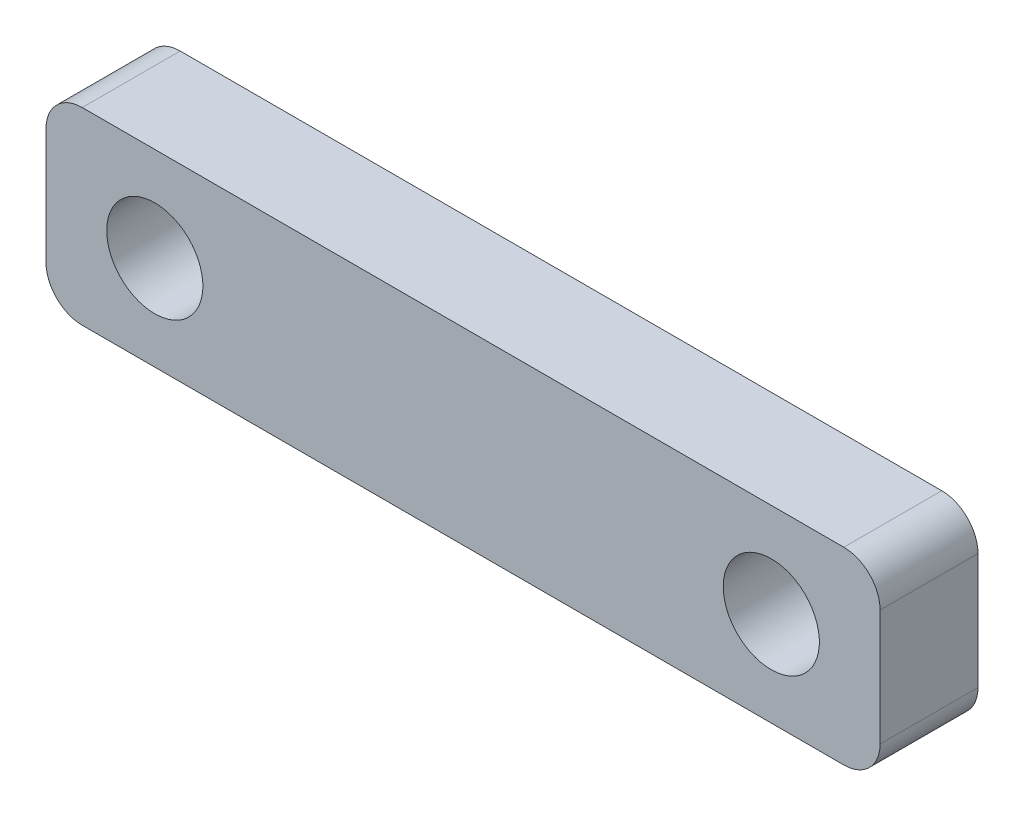
from build123d import *

# Parameters (mm, degrees)
SKETCH2_W           = 23
SKETCH2_H           = 5.2
SKETCH2_R           = 1.325
BOSS_EXTRUDE1_DEPTH = 2.7
FILLET1_R           = 1


with BuildPart() as part:
    # Sketch2 → Boss-Extrude1 (new body)
    with BuildSketch(Plane.XY):
        Rectangle(SKETCH2_W, SKETCH2_H)
        with Locations((-8.5, 0)):
            Circle(SKETCH2_R, mode=Mode.SUBTRACT)
        with Locations((8.5, 0)):
            Circle(SKETCH2_R, mode=Mode.SUBTRACT)
    extrude(amount=BOSS_EXTRUDE1_DEPTH)

    # Fillet1
    fillet1_edges = [part.edges().sort_by_distance(p)[0] for p in [
        (-11.5, 2.6, 1.35),
        (-11.5, -2.6, 1.35),
        (11.5, -2.6, 1.35),
        (11.5, 2.6, 1.35),
    ]]
    fillet(fillet1_edges, radius=FILLET1_R)


solid = part.part
